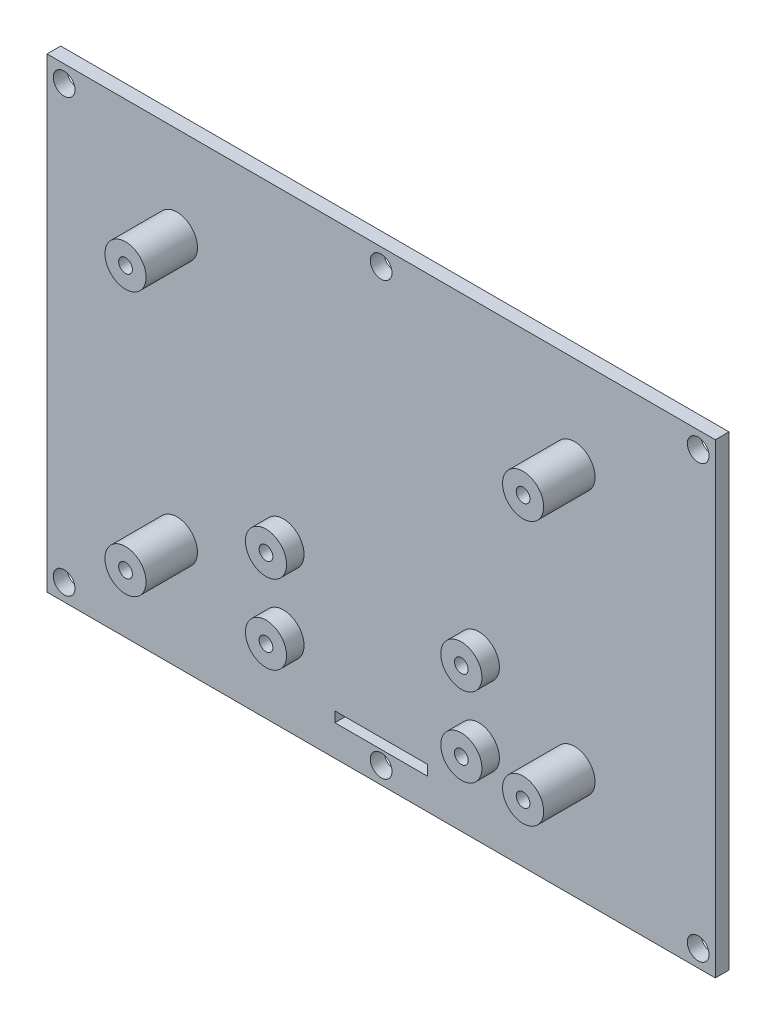
from build123d import *

# Parameters (mm, degrees)
SKETCH1_W           = 195
SKETCH1_H           = 136
SKETCH1_W_2         = 27
SKETCH1_H_2         = 3
BOSS_EXTRUDE1_DEPTH = 2
SKETCH1_3_W         = 195
SKETCH1_3_H         = 136
SKETCH1_3_W_2       = 27
SKETCH1_3_H_2       = 3
BOSS_EXTRUDE2_DEPTH = 2
SKETCH2_R           = 3.175
CUT_EXTRUDE1_DEPTH  = 119.938009064
SKETCH3_R           = 6
SKETCH3_R_2         = 2
BOSS_EXTRUDE3_DEPTH = 5.1
SKETCH4_R           = 6
SKETCH4_R_2         = 2
BOSS_EXTRUDE6_DEPTH = 15


with BuildPart() as part:
    # Sketch1 → Boss-Extrude1 (new body)
    with BuildSketch(Plane.XY):
        Rectangle(SKETCH1_W, SKETCH1_H)
        with Locations((0, -57.5)):
            Rectangle(SKETCH1_W_2, SKETCH1_H_2, mode=Mode.SUBTRACT)
    extrude(amount=-BOSS_EXTRUDE1_DEPTH)

    # Sketch1<3> → Boss-Extrude2 (add)
    with BuildSketch(Plane.XY):
        Rectangle(SKETCH1_3_W, SKETCH1_3_H)
        with Locations((0, -57.5)):
            Rectangle(SKETCH1_3_W_2, SKETCH1_3_H_2, mode=Mode.SUBTRACT)
    extrude(amount=BOSS_EXTRUDE2_DEPTH)

    # Sketch2 → Cut-Extrude1 (cut, through all)
    with BuildSketch(Plane.XY.offset(2)):
        with Locations((-92.5, 63)):
            Circle(SKETCH2_R)
        with Locations((0, 63)):
            Circle(SKETCH2_R)
        with Locations((92.5, 63)):
            Circle(SKETCH2_R)
        with Locations((92.5, -63)):
            Circle(SKETCH2_R)
        with Locations((0, -63)):
            Circle(SKETCH2_R)
        with Locations((-92.5, -63)):
            Circle(SKETCH2_R)
    extrude(amount=-CUT_EXTRUDE1_DEPTH, mode=Mode.SUBTRACT)

    # Sketch3 → Boss-Extrude3 (add)
    with BuildSketch(Plane.XY.offset(2)):
        with Locations((-28.5, -44)):
            Circle(SKETCH3_R)
        with Locations((-28.5, -44)):
            Circle(SKETCH3_R_2, mode=Mode.SUBTRACT)
    boss_extrude3 = extrude(amount=BOSS_EXTRUDE3_DEPTH)

    # Sketch-Pattern1: Boss-Extrude3 at 3 more places
    with Locations((0, 23, 0), (57, 23, 0), (57, 0, 0)):
        add(boss_extrude3)

    # Sketch4 → Boss-Extrude6 (add)
    with BuildSketch(Plane.XY.offset(2)):
        with Locations((-59.585970737, -36.007477459)):
            Circle(SKETCH4_R)
        with Locations((-59.585970737, -36.007477459)):
            Circle(SKETCH4_R_2, mode=Mode.SUBTRACT)
    boss_extrude6 = extrude(amount=BOSS_EXTRUDE6_DEPTH)

    # Sketch-Pattern2: Boss-Extrude6 at 3 more places
    with Locations((0, 77, 0), (116, 77, 0), (116, 0, 0)):
        add(boss_extrude6)


solid = part.part
